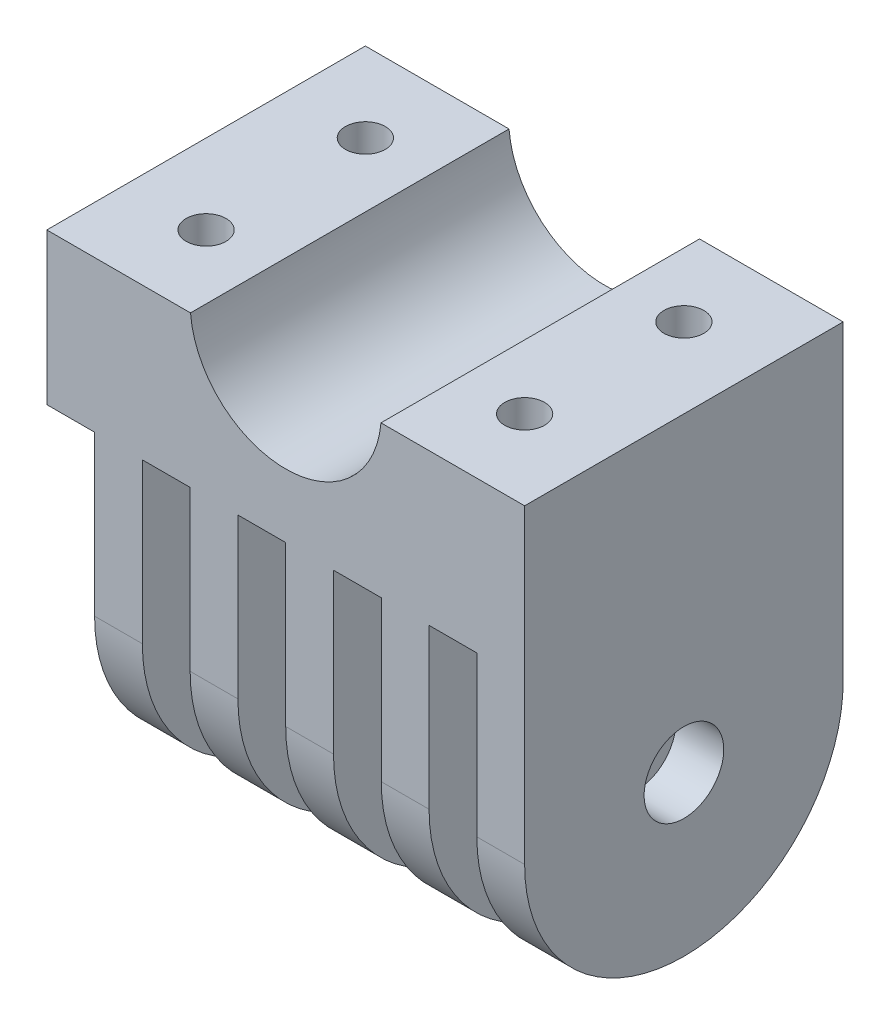
from build123d import *

# Parameters (mm, degrees)
BOSS_EXTRU_1_DEPTH      = 20
ESQUISSE2_R             = 1.25
ENL_V_MAT_EXTRU_1_DEPTH = 8
CONG_1_R                = 10
ESQUISSE3_R             = 2.5
ENL_V_MAT_EXTRU_2_DEPTH = 30


with BuildPart() as part:
    # Esquisse1 → Boss.-Extru.1 (new body)
    with BuildSketch(Plane.XY):
        with BuildLine():
            Line((-15, -0.5), (-15, -10))
            Line((-15, -10), (-12, -10))
            Line((-12, -10), (-12, -30))
            Line((-12, -30), (-9, -30))
            Line((-9, -30), (-9, -10))
            Line((-9, -10), (-6, -10))
            Line((-6, -10), (-6, -30))
            Line((-6, -30), (-3, -30))
            Line((-3, -30), (-3, -10))
            Line((-3, -10), (0, -10))
            Line((0, -10), (0, -30))
            Line((0, -30), (3, -30))
            Line((3, -30), (3, -10))
            Line((3, -10), (6, -10))
            Line((6, -10), (6, -30))
            Line((6, -30), (9, -30))
            Line((9, -30), (9, -10))
            Line((9, -10), (12, -10))
            Line((12, -10), (12, -30))
            Line((12, -30), (15, -30))
            Line((15, -30), (15, -0.5))
            Line((15, -0.5), (5.979130372, -0.5))
            ThreePointArc((5.979130372, -0.5), (0, -6), (-5.979130372, -0.5))
            Line((-5.979130372, -0.5), (-15, -0.5))
        make_face()
    extrude(amount=BOSS_EXTRU_1_DEPTH)

    # Esquisse2 → Enlèv. mat.-Extru.1 (cut)
    with BuildSketch(Plane(origin=(0, -0.5, 0), x_dir=(1, 0, 0), z_dir=(0, 1, 0))):
        with Locations(Location((-10, -5, 0), (0, 0, 180))):
            Circle(ESQUISSE2_R)
        with Locations(Location((-10, -15, 0), (0, 0, 180))):
            Circle(ESQUISSE2_R)
        with Locations(Location((10, -5, 0), (0, 0, 180))):
            Circle(ESQUISSE2_R)
        with Locations(Location((10, -15, 0), (0, 0, 180))):
            Circle(ESQUISSE2_R)
    extrude(amount=-ENL_V_MAT_EXTRU_1_DEPTH, mode=Mode.SUBTRACT)

    # Congé1
    cong_1_edges = [part.edges().sort_by_distance(p)[0] for p in [
        (-10.5, -30, 0),
        (-4.5, -30, 0),
        (1.5, -30, 0),
        (7.5, -30, 0),
        (13.5, -30, 0),
        (13.5, -30, 20),
        (7.5, -30, 20),
        (1.5, -30, 20),
        (-4.5, -30, 20),
        (-10.5, -30, 20),
    ]]
    fillet(cong_1_edges, radius=CONG_1_R - 0.0001)  # a hair under: the kernel refuses the full size

    # Esquisse3 → Enlèv. mat.-Extru.2 (cut)
    with BuildSketch(Plane(origin=(15, 0, 0), x_dir=(0, 0, -1), z_dir=(1, 0, 0))):
        with Locations(Location((-10, -20, 0), (0, 0, 90))):
            Circle(ESQUISSE3_R)
    extrude(amount=-ENL_V_MAT_EXTRU_2_DEPTH, mode=Mode.SUBTRACT)


solid = part.part
